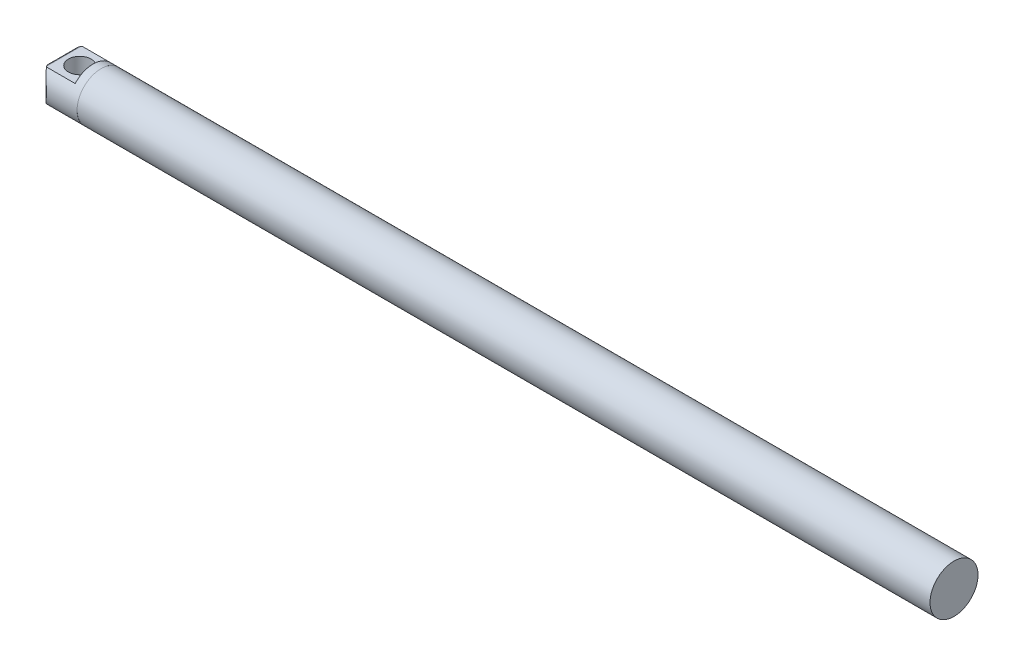
from build123d import *

# Parameters (mm, degrees)
SKETCH2_R               = 4.5
BOSS_EXTRUDE1_DEPTH     = 160
SKETCH3_R               = 4.5
BOSS_EXTRUDE2_DEPTH     = 8
CUT_EXTRUDE1_DEPTH      = 6.5
SKETCH5_R               = 2.125
CUT_EXTRUDE2_DEPTH      = 161.23888417
FILLET2_SIZE            = 3
FILLET2_SIZE_2          = 1
FILLET3_SIZE            = 3
FILLET3_SIZE_2          = 1
CUT_EXTRUDE5_DEPTH      = 161.238884177
CUT_EXTRUDE5_DEPTH_BACK = 161.238884177


with BuildPart() as part:
    # Sketch2 → Boss-Extrude1 (new body)
    with BuildSketch(Plane(origin=(0, 0, 0), x_dir=(0, 0, -1), z_dir=(1, 0, 0))):
        Circle(SKETCH2_R)
    extrude(amount=BOSS_EXTRUDE1_DEPTH)


with BuildPart() as body_2:
    # Sketch3 → Boss-Extrude2 (new body)
    with BuildSketch(Plane.ZY):
        Circle(SKETCH3_R)
    extrude(amount=BOSS_EXTRUDE2_DEPTH)

    # Sketch4 → Cut-Extrude1 (cut)
    with BuildSketch(Plane.ZY.offset(8)):
        with BuildLine():
            ThreePointArc((3.354101966, 3), (0, 4.5), (-3.354101966, 3))
            Line((-3.354101966, 3), (3.354101966, 3))
        make_face()
        with BuildLine():
            Line((3.354101966, -3), (-3.354101966, -3))
            ThreePointArc((-3.354101966, -3), (0, -4.5), (3.354101966, -3))
        make_face()
    extrude(amount=-CUT_EXTRUDE1_DEPTH, mode=Mode.SUBTRACT)

    # Sketch5 → Cut-Extrude2 (cut, through all)
    with BuildSketch(Plane.XZ.offset(3)):
        with Locations(Location((-4, 0, 0), (0, 0, 270))):
            Circle(SKETCH5_R)
    extrude(amount=-CUT_EXTRUDE2_DEPTH, mode=Mode.SUBTRACT)

    # Fillet2
    # an asymmetric fillet: 3, 1 mm, written as the material it takes off along each edge
    with BuildSketch(Plane(origin=(-8, -3, 10.854101966), x_dir=(0, 1, 0), z_dir=(0, 0, -1))) as fillet2_piece_1:
        with BuildLine():
            Bezier((FILLET2_SIZE, 0), (0, 0), (0, FILLET2_SIZE_2), weights=[1, 0.707106781, 1])
            Line((0, FILLET2_SIZE_2), (0, 0))
            Line((0, 0), (FILLET2_SIZE, 0))
        make_face()
    extrude(amount=21.708203932, mode=Mode.SUBTRACT)

    # Fillet3
    # an asymmetric fillet: 3, 1 mm, written as the material it takes off along each edge
    with BuildSketch(Plane(origin=(-8, 3, -10.854101966), x_dir=(0, -1, 0), z_dir=(0, 0, 1))) as fillet3_piece_1:
        with BuildLine():
            Bezier((FILLET3_SIZE, 0), (0, 0), (0, FILLET3_SIZE_2), weights=[1, 0.707106781, 1])
            Line((0, FILLET3_SIZE_2), (0, 0))
            Line((0, 0), (FILLET3_SIZE, 0))
        make_face()
    extrude(amount=21.708203932, mode=Mode.SUBTRACT)

    # Sketch8 → Cut-Extrude5 (cut, two sides: drawn at the far end of the back side and taken through both)
    with BuildSketch(Plane.XZ.offset(3).offset(-CUT_EXTRUDE5_DEPTH_BACK)):
        with BuildLine():
            Line((-7, -3.354101966), (-6.890597967, -3.354101966))
            ThreePointArc((-6.890597967, -3.354101966), (-6.945935342, -3.278288441), (-7, -3.201562119))
            Line((-7, -3.201562119), (-7, -3.354101966))
        make_face()
        with BuildLine():
            Line((-8, -4.5), (-5.75, -4.5))
            ThreePointArc((-5.75, -4.5), (-6.361684668, -3.968245249), (-6.890597967, -3.354101966))
            Line((-6.890597967, -3.354101966), (-7, -3.354101966))
            Line((-7, -3.354101966), (-7, -3.201562119))
            ThreePointArc((-7, -3.201562119), (-7.744182899, -1.677050983), (-8, 0))
            Line((-8, 0), (-8, -4.5))
        make_face()
        with BuildLine():
            Line((-7, 3.354101966), (-7, 3.201562119))
            ThreePointArc((-7, 3.201562119), (-6.945935342, 3.278288441), (-6.890597967, 3.354101966))
            Line((-6.890597967, 3.354101966), (-7, 3.354101966))
        make_face()
        with BuildLine():
            Line((-8, 4.5), (-8, 0))
            ThreePointArc((-8, 0), (-7.744182899, 1.677050983), (-7, 3.201562119))
            Line((-7, 3.201562119), (-7, 3.354101966))
            Line((-7, 3.354101966), (-6.890597967, 3.354101966))
            ThreePointArc((-6.890597967, 3.354101966), (-6.361684668, 3.968245249), (-5.75, 4.5))
            Line((-5.75, 4.5), (-8, 4.5))
        make_face()
    extrude(amount=CUT_EXTRUDE5_DEPTH + CUT_EXTRUDE5_DEPTH_BACK, mode=Mode.SUBTRACT)


solid = Compound([part.part, body_2.part])
